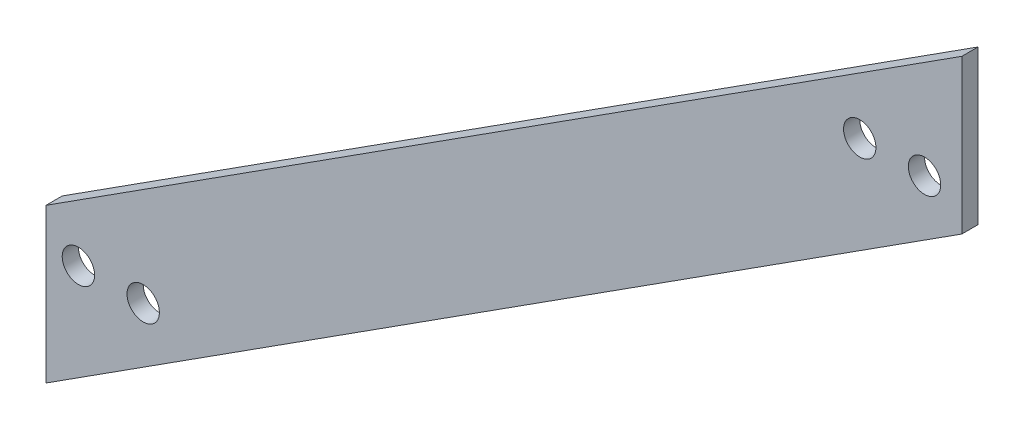
from build123d import *

# Parameters (mm, degrees)
SKETCH1_R           = 4.7625
BOSS_EXTRUDE1_DEPTH = 4.7625


with BuildPart() as part:
    # Sketch1 → Boss-Extrude1 (new body)
    with BuildSketch(Plane.XY):
        Polygon((0, 0), (0, -45.252735849), (269.24, 127.295542021), (269.24, 172.54827787), align=None)
        with Locations((9.525, -10.651818651)):
            Circle(SKETCH1_R, mode=Mode.SUBTRACT)
        with Locations((28.575, -10.651818651)):
            Circle(SKETCH1_R, mode=Mode.SUBTRACT)
        with Locations((239.234787134, 136.668181349)):
            Circle(SKETCH1_R, mode=Mode.SUBTRACT)
        with Locations((258.284787134, 136.668181349)):
            Circle(SKETCH1_R, mode=Mode.SUBTRACT)
    extrude(amount=BOSS_EXTRUDE1_DEPTH)


solid = part.part
